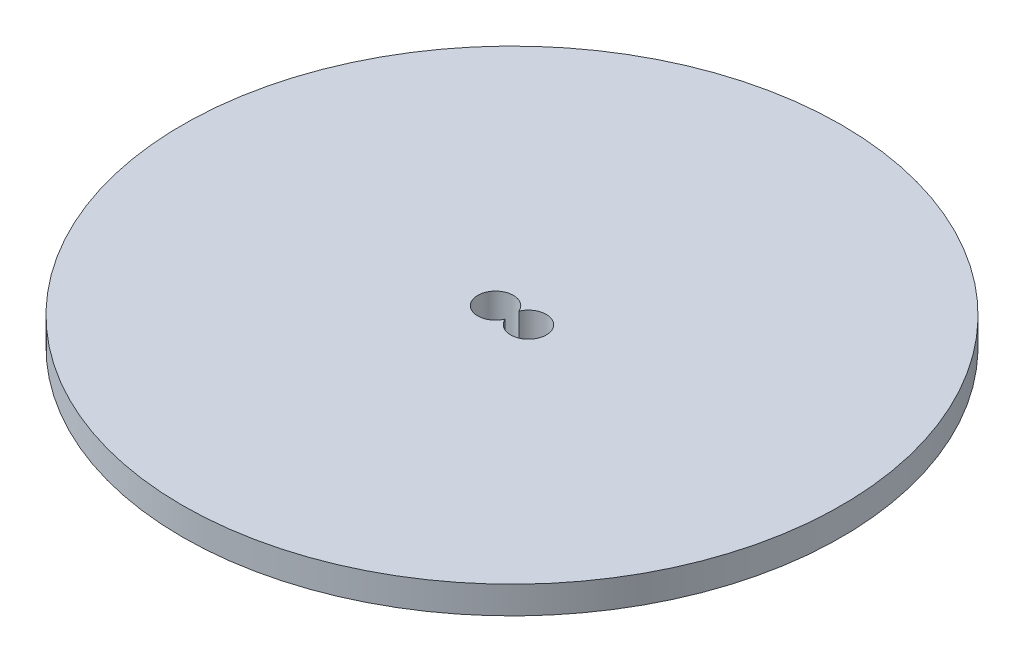
from build123d import *

# Parameters (mm, degrees)
SKETCH1_R           = 60
BOSS_EXTRUDE1_DEPTH = 5
SKETCH3_W           = 14
SKETCH3_H           = 7
BOSS_EXTRUDE2_DEPTH = 5
SKETCH4_R           = 3.25
CUT_EXTRUDE1_DEPTH  = 9
SKETCH7_R           = 1.75
CUT_EXTRUDE2_DEPTH  = 5
FILLET1_R           = 10


with BuildPart() as part:
    # Sketch1 → Boss-Extrude1 (new body)
    with BuildSketch(Plane(origin=(0, 0, 0), x_dir=(1, 0, 0), z_dir=(0, 1, 0))):
        with Locations(Location((0, 0, 0), (0, 0, 270))):
            Circle(SKETCH1_R)
    extrude(amount=BOSS_EXTRUDE1_DEPTH)

    # Sketch3 → Boss-Extrude2 (add)
    with BuildSketch(Plane.XZ):
        Rectangle(SKETCH3_W, SKETCH3_H)
    extrude(amount=BOSS_EXTRUDE2_DEPTH)

    # Sketch4 → Cut-Extrude1 (cut)
    with BuildSketch(Plane(origin=(0, 5, 0), x_dir=(1, 0, 0), z_dir=(0, 1, 0))):
        with Locations((3, 0)):
            Circle(SKETCH4_R)
        with Locations((-3, 0)):
            Circle(SKETCH4_R)
    extrude(amount=-CUT_EXTRUDE1_DEPTH, mode=Mode.SUBTRACT)

    # Sketch7 → Cut-Extrude2 (cut)
    with BuildSketch(Plane(origin=(0, -4, 0), x_dir=(1, 0, 0), z_dir=(0, 1, 0))):
        with Locations(Location((-3, 0, 0), (0, 0, 270))):
            Circle(SKETCH7_R)
        with Locations(Location((3, 0, 0), (0, 0, 270))):
            Circle(SKETCH7_R)
    extrude(amount=-CUT_EXTRUDE2_DEPTH, mode=Mode.SUBTRACT)

    # Fillet1
    # the kernel refuses this fillet: 10 mm, written as the material it adds along each edge
    with BuildSketch(Plane(origin=(7, 0, 3.5), x_dir=(0, 0, 1), z_dir=(-1, 0, 0)), Plane(origin=(-7, 0, -3.5), x_dir=(0, 0, -1), z_dir=(1, 0, 0))) as fillet1_piece_1:
        with BuildLine():
            CenterArc((8.660254038, -10), FILLET1_R, 90, 60)
            Line((0, -5), (-0.173205081, -4.9))
            ThreePointArc((-0.173205081, -4.9), (-0.2, -2.5), (-0.2, 0))
            Line((-0.2, 0), (0, 0.2))
            Line((0, 0.2), (8.660254038, 0.2))
            Line((8.660254038, 0.2), (8.660254038, 0))
        make_face()
    extrude(amount=14)
    with BuildSketch(Plane(origin=(7, 0, -3.5), x_dir=(1, 0, 0), z_dir=(0, 0, 1)), Plane(origin=(-7, 0, 3.5), x_dir=(-1, 0, 0), z_dir=(0, 0, -1))) as fillet1_piece_2:
        with BuildLine():
            CenterArc((8.660254038, -10), FILLET1_R, 90, 60)
            Line((0, -5), (-0.173205081, -4.9))
            ThreePointArc((-0.173205081, -4.9), (-0.2, -2.5), (-0.2, 0))
            Line((-0.2, 0), (0, 0.2))
            Line((0, 0.2), (8.660254038, 0.2))
            Line((8.660254038, 0.2), (8.660254038, 0))
        make_face()
    extrude(amount=7)
    with BuildSketch(Plane(origin=(28.650635095, 0, 3.5), x_dir=(0, 0, 1), z_dir=(-1, 0, 0))) as fillet1_piece_3a_section:
        with BuildLine():
            CenterArc((8.660254038, -10), FILLET1_R, 90, 60)
            Line((0, -5), (-0.173205081, -4.9))
            ThreePointArc((-0.173205081, -4.9), (-0.2, -2.5), (-0.2, 0))
            Line((-0.2, 0), (0, 0.2))
            Line((0, 0.2), (8.660254038, 0.2))
            Line((8.660254038, 0.2), (8.660254038, 0))
        make_face()
    fillet1_piece_3a = extrude(amount=35.650635095, mode=Mode.PRIVATE)
    fillet1_piece_3a = split(fillet1_piece_3a, bisect_by=Plane(origin=(7, -1.295167111, 5.663104458), z_dir=(1, 0, 0)), keep=Keep.TOP, mode=Mode.PRIVATE)
    with BuildSketch(Plane(origin=(7, 0, -3.5), x_dir=(1, 0, 0), z_dir=(0, 0, 1))) as fillet1_piece_3b_section:
        with BuildLine():
            CenterArc((8.660254038, -10), FILLET1_R, 90, 60)
            Line((0, -5), (-0.173205081, -4.9))
            ThreePointArc((-0.173205081, -4.9), (-0.2, -2.5), (-0.2, 0))
            Line((-0.2, 0), (0, 0.2))
            Line((0, 0.2), (8.660254038, 0.2))
            Line((8.660254038, 0.2), (8.660254038, 0))
        make_face()
    fillet1_piece_3b = extrude(amount=28.650635095, mode=Mode.PRIVATE)
    fillet1_piece_3b = split(fillet1_piece_3b, bisect_by=Plane(origin=(9.163104458, -1.295167111, 3.5), z_dir=(0, 0, 1)), keep=Keep.TOP, mode=Mode.PRIVATE)
    fillet1_piece_3 = fillet1_piece_3a & fillet1_piece_3b
    add(fillet1_piece_3)
    with BuildSketch(Plane(origin=(-7, 0, 25.150635095), x_dir=(-1, 0, 0), z_dir=(0, 0, -1))) as fillet1_piece_4a_section:
        with BuildLine():
            CenterArc((8.660254038, -10), FILLET1_R, 90, 60)
            Line((0, -5), (-0.173205081, -4.9))
            ThreePointArc((-0.173205081, -4.9), (-0.2, -2.5), (-0.2, 0))
            Line((-0.2, 0), (0, 0.2))
            Line((0, 0.2), (8.660254038, 0.2))
            Line((8.660254038, 0.2), (8.660254038, 0))
        make_face()
    fillet1_piece_4a = extrude(amount=28.650635095, mode=Mode.PRIVATE)
    fillet1_piece_4a = split(fillet1_piece_4a, bisect_by=Plane(origin=(-9.163104458, -1.295167111, 3.5), z_dir=(0, 0, 1)), keep=Keep.TOP, mode=Mode.PRIVATE)
    with BuildSketch(Plane(origin=(7, 0, 3.5), x_dir=(0, 0, 1), z_dir=(-1, 0, 0))) as fillet1_piece_4b_section:
        with BuildLine():
            CenterArc((8.660254038, -10), FILLET1_R, 90, 60)
            Line((0, -5), (-0.173205081, -4.9))
            ThreePointArc((-0.173205081, -4.9), (-0.2, -2.5), (-0.2, 0))
            Line((-0.2, 0), (0, 0.2))
            Line((0, 0.2), (8.660254038, 0.2))
            Line((8.660254038, 0.2), (8.660254038, 0))
        make_face()
    fillet1_piece_4b = extrude(amount=35.650635095, mode=Mode.PRIVATE)
    fillet1_piece_4b = split(fillet1_piece_4b, bisect_by=Plane(origin=(-7, -1.295167111, 5.663104458), z_dir=(-1, 0, 0)), keep=Keep.TOP, mode=Mode.PRIVATE)
    fillet1_piece_4 = fillet1_piece_4a & fillet1_piece_4b
    add(fillet1_piece_4)
    with BuildSketch(Plane(origin=(7, 0, -25.150635095), x_dir=(1, 0, 0), z_dir=(0, 0, 1))) as fillet1_piece_5a_section:
        with BuildLine():
            CenterArc((8.660254038, -10), FILLET1_R, 90, 60)
            Line((0, -5), (-0.173205081, -4.9))
            ThreePointArc((-0.173205081, -4.9), (-0.2, -2.5), (-0.2, 0))
            Line((-0.2, 0), (0, 0.2))
            Line((0, 0.2), (8.660254038, 0.2))
            Line((8.660254038, 0.2), (8.660254038, 0))
        make_face()
    fillet1_piece_5a = extrude(amount=28.650635095, mode=Mode.PRIVATE)
    fillet1_piece_5a = split(fillet1_piece_5a, bisect_by=Plane(origin=(9.163104458, -1.295167111, -3.5), z_dir=(0, 0, -1)), keep=Keep.TOP, mode=Mode.PRIVATE)
    with BuildSketch(Plane(origin=(-7, 0, -3.5), x_dir=(0, 0, -1), z_dir=(1, 0, 0))) as fillet1_piece_5b_section:
        with BuildLine():
            CenterArc((8.660254038, -10), FILLET1_R, 90, 60)
            Line((0, -5), (-0.173205081, -4.9))
            ThreePointArc((-0.173205081, -4.9), (-0.2, -2.5), (-0.2, 0))
            Line((-0.2, 0), (0, 0.2))
            Line((0, 0.2), (8.660254038, 0.2))
            Line((8.660254038, 0.2), (8.660254038, 0))
        make_face()
    fillet1_piece_5b = extrude(amount=35.650635095, mode=Mode.PRIVATE)
    fillet1_piece_5b = split(fillet1_piece_5b, bisect_by=Plane(origin=(7, -1.295167111, -5.663104458), z_dir=(1, 0, 0)), keep=Keep.TOP, mode=Mode.PRIVATE)
    fillet1_piece_5 = fillet1_piece_5a & fillet1_piece_5b
    add(fillet1_piece_5)
    with BuildSketch(Plane(origin=(-7, 0, 3.5), x_dir=(-1, 0, 0), z_dir=(0, 0, -1))) as fillet1_piece_6a_section:
        with BuildLine():
            CenterArc((8.660254038, -10), FILLET1_R, 90, 60)
            Line((0, -5), (-0.173205081, -4.9))
            ThreePointArc((-0.173205081, -4.9), (-0.2, -2.5), (-0.2, 0))
            Line((-0.2, 0), (0, 0.2))
            Line((0, 0.2), (8.660254038, 0.2))
            Line((8.660254038, 0.2), (8.660254038, 0))
        make_face()
    fillet1_piece_6a = extrude(amount=28.650635095, mode=Mode.PRIVATE)
    fillet1_piece_6a = split(fillet1_piece_6a, bisect_by=Plane(origin=(-9.163104458, -1.295167111, -3.5), z_dir=(0, 0, -1)), keep=Keep.TOP, mode=Mode.PRIVATE)
    with BuildSketch(Plane(origin=(-28.650635095, 0, -3.5), x_dir=(0, 0, -1), z_dir=(1, 0, 0))) as fillet1_piece_6b_section:
        with BuildLine():
            CenterArc((8.660254038, -10), FILLET1_R, 90, 60)
            Line((0, -5), (-0.173205081, -4.9))
            ThreePointArc((-0.173205081, -4.9), (-0.2, -2.5), (-0.2, 0))
            Line((-0.2, 0), (0, 0.2))
            Line((0, 0.2), (8.660254038, 0.2))
            Line((8.660254038, 0.2), (8.660254038, 0))
        make_face()
    fillet1_piece_6b = extrude(amount=35.650635095, mode=Mode.PRIVATE)
    fillet1_piece_6b = split(fillet1_piece_6b, bisect_by=Plane(origin=(-7, -1.295167111, -5.663104458), z_dir=(-1, 0, 0)), keep=Keep.TOP, mode=Mode.PRIVATE)
    fillet1_piece_6 = fillet1_piece_6a & fillet1_piece_6b
    add(fillet1_piece_6)


solid = part.part
